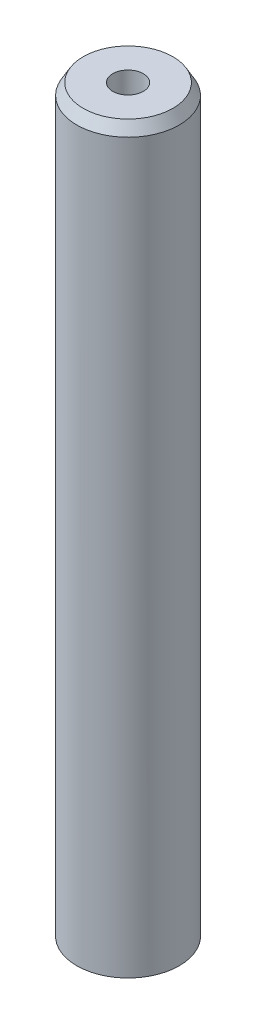
from build123d import *
from OCP.BRepFilletAPI import BRepFilletAPI_MakeChamfer

# Parameters (mm, degrees)
SKETCH1_R           = 12.5
BOSS_EXTRUDE1_DEPTH = 181.878522233
SKETCH2_R           = 3.737096785
CUT_EXTRUDE1_DEPTH  = 183.735592728
CHAMFER1_SIZE       = 2.725557316
CHAMFER1_SIZE2      = 1.57360125


with BuildPart() as part:
    # Sketch1 → Boss-Extrude1 (new body)
    with BuildSketch(Plane(origin=(0, 0, 0), x_dir=(1, 0, 0), z_dir=(0, 1, 0))):
        Circle(SKETCH1_R)
    extrude(amount=BOSS_EXTRUDE1_DEPTH)

    # Sketch2 → Cut-Extrude1 (cut, through all)
    with BuildSketch(Plane(origin=(0, 0, 0), x_dir=(1, 0, 0), z_dir=(0, 1, 0))):
        Circle(SKETCH2_R)
    extrude(amount=CUT_EXTRUDE1_DEPTH, mode=Mode.SUBTRACT)

    # Chamfer1: one chamfer whose edges measure the first distance from different faces: ONE call of the kernel's chamfer builder (chamfer() names one face for all edges)
    chamfer1_edges_1 = [part.edges().sort_by_distance(p)[0] for p in [
        (-12.5, 181.878522233, 0),
    ]]
    chamfer1_side_1 = [part.faces().sort_by_distance(p)[0] for p in [
        (-12.5, 90.939261116, 0),
    ]]
    chamfer1_edges_2 = [part.edges().sort_by_distance(p)[0] for p in [
        (-12.5, 0, 0),
    ]]
    chamfer1_side_2 = [part.faces().sort_by_distance(p)[0] for p in [
        (-12.146446609, 0, 0),
    ]]
    chamfer1 = BRepFilletAPI_MakeChamfer(part.part.solid().wrapped)
    for e in chamfer1_edges_1:
        chamfer1.Add(CHAMFER1_SIZE, CHAMFER1_SIZE2, e.wrapped, chamfer1_side_1[0].wrapped)  # the first distance lies on this face
    for e in chamfer1_edges_2:
        chamfer1.Add(CHAMFER1_SIZE, CHAMFER1_SIZE2, e.wrapped, chamfer1_side_2[0].wrapped)  # the first distance lies on this face
    add(Compound.cast(chamfer1.Shape()), mode=Mode.REPLACE)


solid = part.part
